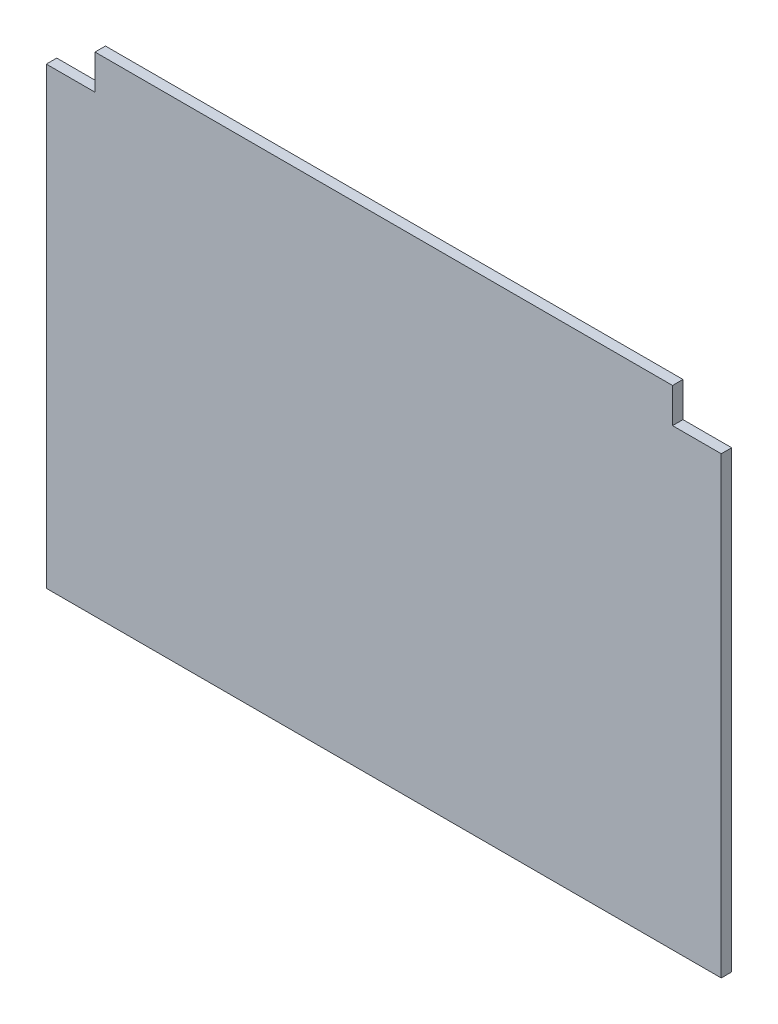
from build123d import *

# Parameters (mm, degrees)
SKETCH1_W           = 388
SKETCH1_H           = 281
BOSS_EXTRUDE1_DEPTH = 6
SKETCH2_W           = 28
SKETCH2_H           = 20
CUT_EXTRUDE1_DEPTH  = 10


with BuildPart() as part:
    # Sketch1 → Boss-Extrude1 (new body)
    with BuildSketch(Plane.XY):
        with Locations((165.428571429, 117.604761905)):
            Rectangle(SKETCH1_W, SKETCH1_H)
    extrude(amount=BOSS_EXTRUDE1_DEPTH)

    # Sketch2 → Cut-Extrude1 (cut)
    with BuildSketch(Plane.XY.offset(6)):
        with Locations((-14.571428571, 248.104761905)):
            Rectangle(SKETCH2_W, SKETCH2_H)
        with Locations((345.428571429, 248.104761905)):
            Rectangle(SKETCH2_W, SKETCH2_H)
    extrude(amount=-CUT_EXTRUDE1_DEPTH, mode=Mode.SUBTRACT)


solid = part.part
